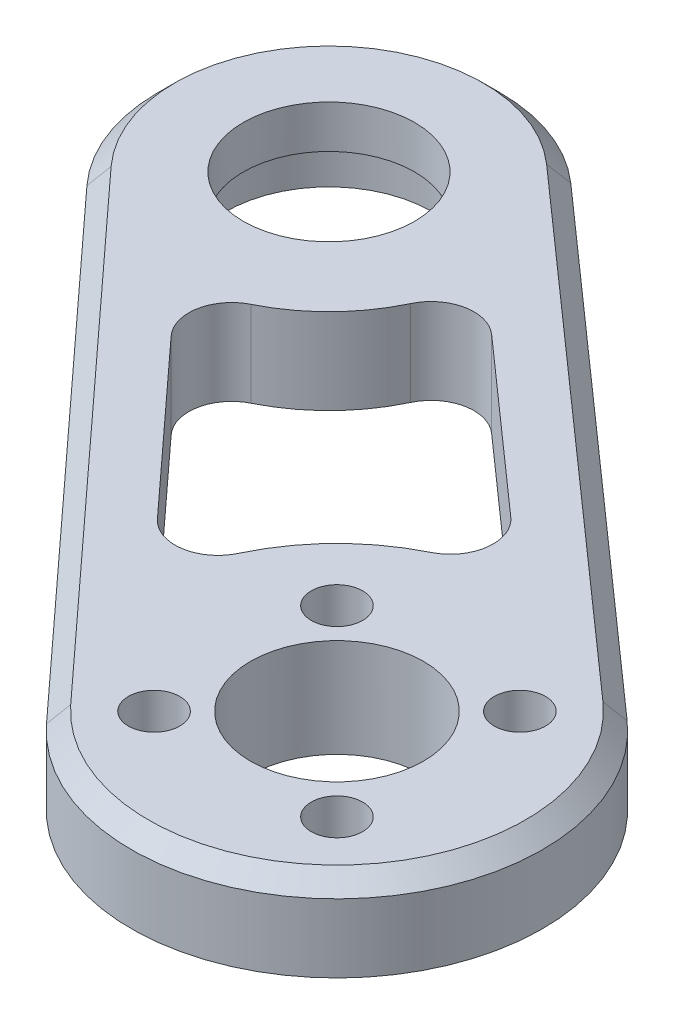
from build123d import *

# Parameters (mm, degrees)
SKETCH1_R              = 10.1
SKETCH1_R_2            = 10
MAIN_BODY_DEPTH        = 10
SKETCH2_R              = 12
BEARING_RECESS_DEPTH   = 5
STANDOFF_START         = 1.5
SKETCH3_R              = 21.5
SKETCH3_R_2            = 10.1
STANDOFF_SECTION_DEPTH = 1.5
SKETCH4_R              = 3
M6_BOLT_HOLES_DEPTH    = 107.03398004
CHAMFER1_SIZE          = 2


with BuildPart() as part:
    # Sketch1 → Main Body (new body)
    with BuildSketch(Plane(origin=(0, 0, 0), x_dir=(1, 0, 0), z_dir=(0, 1, 0))):
        with BuildLine():
            Line((-69.741518057, 40.551033083), (-17.689821668, -16.219439242))
            ThreePointArc((-17.689821668, -16.219439242), (17.115072934, -16.824811395), (15.914514265, 17.96463848))
            Line((15.914514265, 17.96463848), (-41.737904779, 69.037764518))
            ThreePointArc((-41.737904779, 69.037764518), (-69.262560778, 68.087908614), (-69.741518057, 40.551033083))
        make_face()
        Circle(SKETCH1_R, mode=Mode.SUBTRACT)
        with Locations((-55, 54.067232452)):
            Circle(SKETCH1_R_2, mode=Mode.SUBTRACT)
        with BuildLine():
            Line((-47.625471592, 28.267691162), (-29.927098797, 8.964862385))
            ThreePointArc((-29.927098797, 8.964862385), (-25.488644513, 7.400949716), (-21.717284924, 10.215651499))
            ThreePointArc((-21.717284924, 10.215651499), (-17.115072934, 16.824811395), (-10.585592312, 21.539388))
            ThreePointArc((-10.585592312, 21.539388), (-7.835804554, 25.358336357), (-9.475400239, 29.769393516))
            Line((-9.475400239, 29.769393516), (-29.078104388, 47.135037426))
            ThreePointArc((-29.078104388, 47.135037426), (-33.398420323, 48.290403264), (-36.914902554, 45.527370018))
            ThreePointArc((-36.914902554, 45.527370018), (-40.737439222, 40.046556289), (-46.152073662, 36.130839294))
            ThreePointArc((-46.152073662, 36.130839294), (-48.85455966, 32.56761471), (-47.625471592, 28.267691162))
        make_face(mode=Mode.SUBTRACT)
    extrude(amount=MAIN_BODY_DEPTH)

    # Sketch2 → Bearing Recess (cut)
    with BuildSketch(Plane.XZ):
        with Locations((-55, -54.067232452)):
            Circle(SKETCH2_R)
    extrude(amount=-BEARING_RECESS_DEPTH, mode=Mode.SUBTRACT)

    # Sketch3 → Standoff Section (add)
    with BuildSketch(Plane.XZ.offset(STANDOFF_START)):
        Circle(SKETCH3_R)
        Circle(SKETCH3_R_2, mode=Mode.SUBTRACT)
    extrude(amount=-STANDOFF_SECTION_DEPTH)

    # Sketch4 → M6 Bolt holes (cut, through all)
    with BuildSketch(Plane.XZ.offset(1.5)):
        with Locations((-10.677312396, 10.677312396)):
            Circle(SKETCH4_R)
        with Locations((10.677312396, 10.677312396)):
            Circle(SKETCH4_R)
        with Locations((10.677312396, -10.677312396)):
            Circle(SKETCH4_R)
        with Locations((-10.677312396, -10.677312396)):
            Circle(SKETCH4_R)
    extrude(amount=-M6_BOLT_HOLES_DEPTH, mode=Mode.SUBTRACT)

    # Chamfer1
    chamfer1_edges = [part.edges().sort_by_distance(p)[0] for p in [
        (17.115072934, 10, 16.824811395),
        (-12.911695257, 10, -43.501201499),
        (-43.715669863, 10, -12.16579692),
        (-69.262560778, 10, -68.087908614),
    ]]
    chamfer(chamfer1_edges, length=CHAMFER1_SIZE)


solid = part.part
